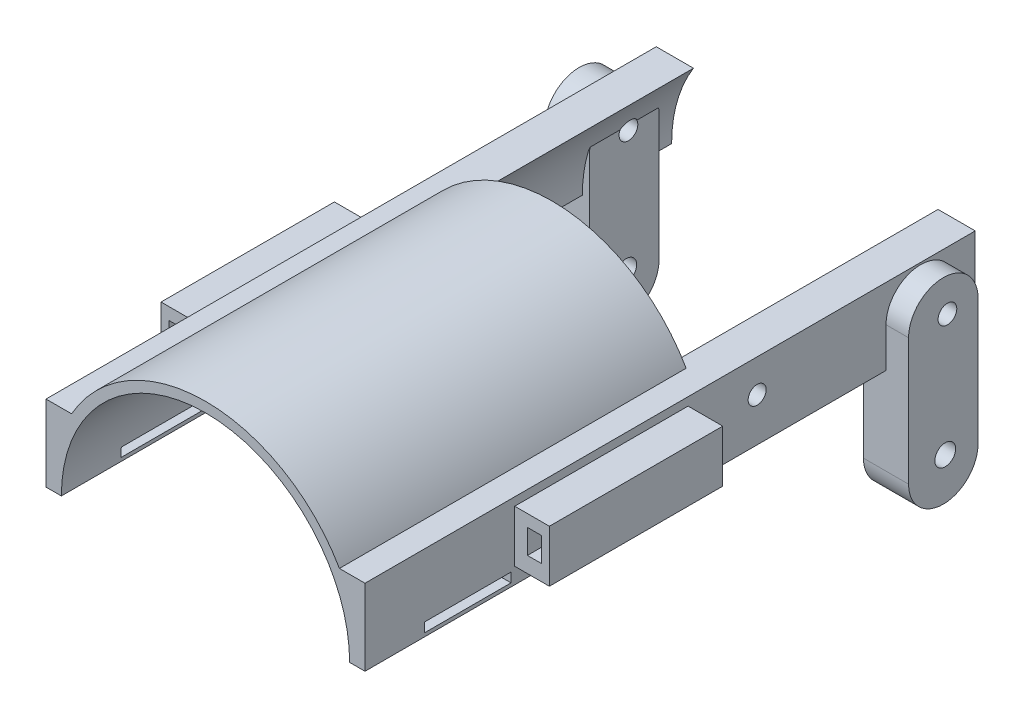
from build123d import *

# Parameters (mm, degrees)
SKETCH1_R           = 44.45
BOSS_EXTRUDE1_DEPTH = 100
CUT_EXTRUDE1_START  = -100
CUT_EXTRUDE1_DEPTH  = 100
SKETCH8_W           = 176
SKETCH8_H           = 22
BOSS_EXTRUDE4_DEPTH = 46
CUT_EXTRUDE4_DEPTH  = 188.263991467
BOSS_EXTRUDE5_DEPTH = 6.5
SKETCH13_R          = 2.7
SKETCH13_R_2        = 2.5
CUT_EXTRUDE6_DEPTH  = 152.660154688
SKETCH14_W          = 50
SKETCH14_H          = 15
BOSS_EXTRUDE7_DEPTH = 10
SKETCH16_W          = 4
SKETCH16_H          = 7
CUT_EXTRUDE8_DEPTH  = 60
SKETCH17_R          = 2.6
CUT_EXTRUDE9_DEPTH  = 150.598805209
SKETCH18_W          = 25
SKETCH18_H          = 2.7
CUT_EXTRUDE10_DEPTH = 150.598805209
SKETCH20_R          = 3
CUT_EXTRUDE11_DEPTH = 155.104031485


with BuildPart() as part:
    # Sketch1 → Boss-Extrude1 (new body)
    with BuildSketch(Plane.XY):
        Circle(SKETCH1_R)
    extrude(amount=BOSS_EXTRUDE1_DEPTH)

    # Sketch2 → Cut-Extrude1 (cut)
    with BuildSketch(Plane.XY.offset(100).offset(CUT_EXTRUDE1_START)):
        with BuildLine():
            Line((-44.45, 0), (44.45, 0))
            ThreePointArc((44.45, 0), (0, -44.45), (-44.45, 0))
        make_face()
    extrude(amount=CUT_EXTRUDE1_DEPTH, mode=Mode.SUBTRACT)

    # Sketch8 → Boss-Extrude4 (add, symmetric)
    with BuildSketch(Plane(origin=(0, 0, 0), x_dir=(0, 0, -1), z_dir=(1, 0, 0))):
        with Locations((-12, 11)):
            Rectangle(SKETCH8_W, SKETCH8_H)
    extrude(amount=BOSS_EXTRUDE4_DEPTH, both=True)

    # Sketch9 → Cut-Extrude4 (cut, through all)
    with BuildSketch(Plane.XY.offset(100)):
        with BuildLine():
            Line((-41.568504669, 0), (41.568504669, 0))
            ThreePointArc((41.568504669, 0), (0, 41.568504669), (-41.568504669, 0))
        make_face()
    extrude(amount=-CUT_EXTRUDE4_DEPTH, mode=Mode.SUBTRACT)

    # Sketch10 → Boss-Extrude5 (add, symmetric)
    with BuildSketch(Plane.ZY.offset(46)):
        with BuildLine():
            Line((-70.29491481, -25.147270815), (-70.29491481, 11.422774745))
            ThreePointArc((-70.29491481, 11.422774745), (-60.281442569, 21.436246986), (-50.267970329, 11.422774745))
            Line((-50.267970329, 11.422774745), (-50.267970329, -25.147270815))
            ThreePointArc((-50.267970329, -25.147270815), (-60.281442569, -35.160743055), (-70.29491481, -25.147270815))
        make_face()
    boss_extrude5 = extrude(amount=BOSS_EXTRUDE5_DEPTH, both=True)

    # Mirror1: Boss-Extrude5 across plane
    add(boss_extrude5.mirror(Plane(origin=(0, 0, 0), x_dir=(0, 0, 1), z_dir=(1, 0, 0))))

    # Sketch13 → Cut-Extrude6 (cut, through all)
    with BuildSketch(Plane.ZY.offset(52.5)):
        with Locations((-61.476028807, 11.741607312)):
            Circle(SKETCH13_R)
        with Locations((-64.176028807, 47.7566912)):
            Circle(SKETCH13_R_2)
    extrude(amount=-CUT_EXTRUDE6_DEPTH, mode=Mode.SUBTRACT)

    # Sketch14 → Boss-Extrude7 (add, symmetric)
    with BuildSketch(Plane(origin=(46, 0, 0), x_dir=(0, 0, -1), z_dir=(1, 0, 0))):
        with Locations((-31.821691991, 12.143744065)):
            Rectangle(SKETCH14_W, SKETCH14_H)
    boss_extrude7 = extrude(amount=BOSS_EXTRUDE7_DEPTH, both=True)

    # Mirror4: Boss-Extrude7 across plane
    add(boss_extrude7.mirror(Plane(origin=(0, 0, 0), x_dir=(0, 0, 1), z_dir=(1, 0, 0))))

    # Sketch16 → Cut-Extrude8 (cut)
    with BuildSketch(Plane.XY.offset(56.821691991)):
        with Locations((-51.668879936, 12.686100347)):
            Rectangle(SKETCH16_W, SKETCH16_H)
    cut_extrude8 = extrude(amount=-CUT_EXTRUDE8_DEPTH, mode=Mode.SUBTRACT)

    # Mirror5: Cut-Extrude8 across plane
    add(cut_extrude8.mirror(Plane(origin=(0, 0, 0), x_dir=(0, 0, 1), z_dir=(1, 0, 0))), mode=Mode.SUBTRACT)

    # Sketch17 → Cut-Extrude9 (cut, through all)
    with BuildSketch(Plane.ZY.offset(46)):
        with Locations((-13.105405192, 12.511801306)):
            Circle(SKETCH17_R)
    extrude(amount=-CUT_EXTRUDE9_DEPTH, mode=Mode.SUBTRACT)

    # Sketch18 → Cut-Extrude10 (cut, through all)
    with BuildSketch(Plane.ZY.offset(46)):
        with Locations((28.995488646, 2.378565717)):
            Rectangle(SKETCH18_W, SKETCH18_H)
        with Locations((70.373227287, 2.378565717)):
            Rectangle(SKETCH18_W, SKETCH18_H)
    extrude(amount=-CUT_EXTRUDE10_DEPTH, mode=Mode.SUBTRACT)

    # Sketch20 → Cut-Extrude11 (cut, through all)
    with BuildSketch(Plane.ZY.offset(52.5)):
        with Locations((-60.84928639, -23.088880019)):
            Circle(SKETCH20_R)
    extrude(amount=-CUT_EXTRUDE11_DEPTH, mode=Mode.SUBTRACT)


solid = part.part
